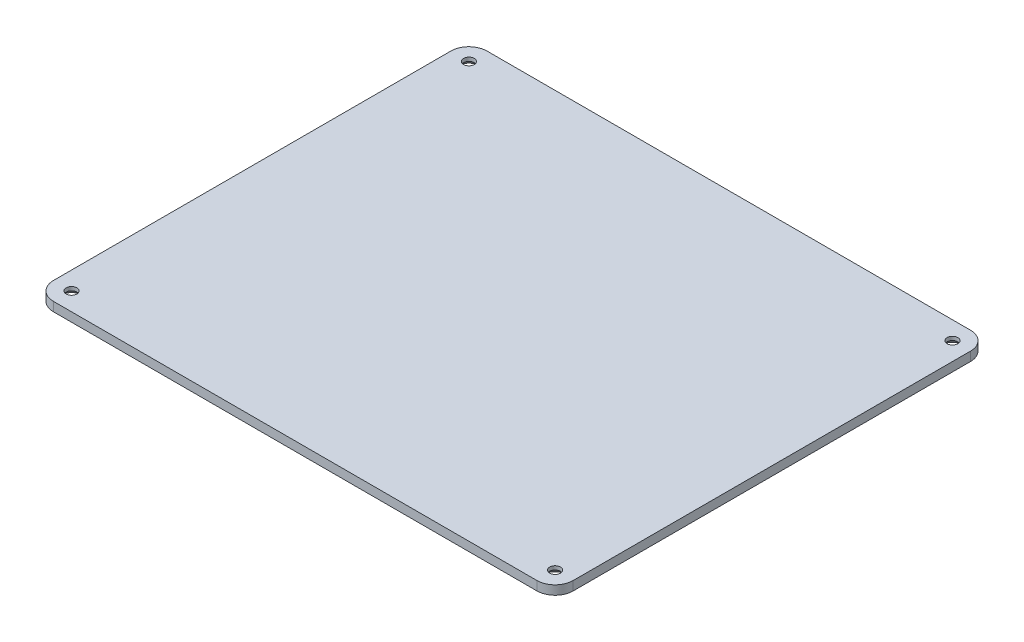
from build123d import *

# Parameters (mm, degrees)
SKETCH1_W                      = 86.201
SKETCH1_H                      = 71.913
BOSS_EXTRUDE1_DEPTH            = 1.5
FILLET1_R                      = 3
F_2_56_TAPPED_HOLE1_AT_2_COUNT = 2
F_2_56_TAPPED_HOLE1_AT_2_PITCH = 80.201
F_2_56_TAPPED_HOLE1_AT_3_COUNT = 2
F_2_56_TAPPED_HOLE1_AT_3_PITCH = 103.811001199
F_2_56_TAPPED_HOLE1_AT_4_COUNT = 2
F_2_56_TAPPED_HOLE1_AT_4_PITCH = 65.913


with BuildPart() as part:
    # Sketch1 → Boss-Extrude1 (new body)
    with BuildSketch(Plane(origin=(0, 0, 0), x_dir=(1, 0, 0), z_dir=(0, 1, 0))):
        Rectangle(SKETCH1_W, SKETCH1_H)
    extrude(amount=BOSS_EXTRUDE1_DEPTH)

    # Fillet1
    fillet1_edges = [part.edges().sort_by_distance(p)[0] for p in [
        (-43.1005, 0.75, 35.9565),
        (-43.1005, 0.75, -35.9565),
        (43.1005, 0.75, -35.9565),
        (43.1005, 0.75, 35.9565),
    ]]
    fillet(fillet1_edges, radius=FILLET1_R)

    # Sketch4 → #2-56 Tapped Hole1 (revolve, cut)
    with BuildSketch(Plane(origin=(-40.1005, 0, 32.9565), x_dir=(0, 0, -1), z_dir=(1, 0, 0))):
        Polygon((0, 0), (0, 1.5), (0.889, 1.5), (0.889, 0.889), (1.778, 0), align=None)
    f_2_56_tapped_hole1 = revolve(axis=Axis((-40.1005, -6.35, 32.9565), (0, 1, 0)), mode=Mode.SUBTRACT)

    # #2-56 Tapped Hole1 at 2: #2-56 Tapped Hole1 ×2
    with Locations(*[(i * F_2_56_TAPPED_HOLE1_AT_2_PITCH, 0, 0) for i in range(1, F_2_56_TAPPED_HOLE1_AT_2_COUNT)]):
        add(f_2_56_tapped_hole1, mode=Mode.SUBTRACT)

    # #2-56 Tapped Hole1 at 3: #2-56 Tapped Hole1 ×2
    with Locations(*[Vector(0.7725674453907951, 0, -0.634932706924396) * (i * F_2_56_TAPPED_HOLE1_AT_3_PITCH) for i in range(1, F_2_56_TAPPED_HOLE1_AT_3_COUNT)]):
        add(f_2_56_tapped_hole1, mode=Mode.SUBTRACT)

    # #2-56 Tapped Hole1 at 4: #2-56 Tapped Hole1 ×2
    with Locations(*[(0, 0, -i * F_2_56_TAPPED_HOLE1_AT_4_PITCH) for i in range(1, F_2_56_TAPPED_HOLE1_AT_4_COUNT)]):
        add(f_2_56_tapped_hole1, mode=Mode.SUBTRACT)


solid = part.part
